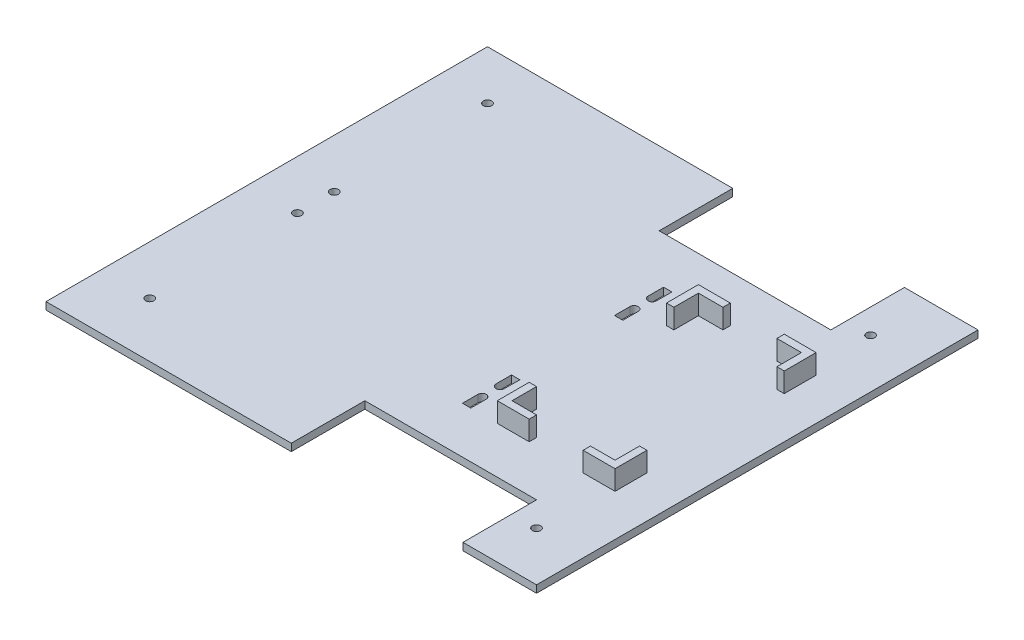
from build123d import *

# Parameters (mm, degrees)
SKETCH1_R           = 43.18
BOSS_EXTRUDE1_DEPTH = 76.2
BOSS_EXTRUDE4_DEPTH = 203.2


with BuildPart() as part:
    # Sketch1 → Boss-Extrude1 (new body)
    with BuildSketch(Plane(origin=(0, 0, 0), x_dir=(1, 0, 0), z_dir=(0, 1, 0))):
        Polygon((-48.943073508, 29.635887653), (1729.056926492, 29.635887653), (1729.056926492, -732.364112347), (2491.056926492, -732.364112347), (2491.056926492, 3839.635887653), (1729.056926492, 3839.635887653), (1729.056926492, 3077.635887653), (-48.943073508, 3077.635887653), (-48.943073508, 3839.635887653), (-2588.943073508, 3839.635887653), (-2588.943073508, -732.364112347), (-48.943073508, -732.364112347), align=None)
        with Locations((-2080.943073508, -166.508163088)):
            Circle(SKETCH1_R, mode=Mode.SUBTRACT)
        with Locations((-2080.943073508, 1744.135887653)):
            Circle(SKETCH1_R, mode=Mode.SUBTRACT)
        with Locations((-2080.943073508, 1363.135887653)):
            Circle(SKETCH1_R, mode=Mode.SUBTRACT)
        with Locations((-2080.943073508, 3331.635887653)):
            Circle(SKETCH1_R, mode=Mode.SUBTRACT)
        with Locations((1983.056926492, -224.364112347)):
            Circle(SKETCH1_R, mode=Mode.SUBTRACT)
        with Locations((1983.056926492, 3235.099053778)):
            Circle(SKETCH1_R, mode=Mode.SUBTRACT)
        with BuildLine():
            Line((565.736926492, 2435.015887653), (565.736926492, 2595.035887653))
            Line((565.736926492, 2595.035887653), (479.376926492, 2595.035887653))
            Line((479.376926492, 2595.035887653), (479.376926492, 2435.015887653))
            ThreePointArc((479.376926492, 2435.015887653), (522.556926492, 2391.835887653), (565.736926492, 2435.015887653))
        make_face(mode=Mode.SUBTRACT)
        with BuildLine():
            Line((565.736926492, 2247.055887653), (565.736926492, 2087.035887653))
            Line((565.736926492, 2087.035887653), (479.376926492, 2087.035887653))
            Line((479.376926492, 2087.035887653), (479.376926492, 2247.055887653))
            ThreePointArc((479.376926492, 2247.055887653), (522.556926492, 2290.235887653), (565.736926492, 2247.055887653))
        make_face(mode=Mode.SUBTRACT)
        with BuildLine():
            Line((479.376926492, 1020.235887653), (479.376926492, 860.215887653))
            ThreePointArc((479.376926492, 860.215887653), (522.556926492, 817.035887653), (565.736926492, 860.215887653))
            Line((565.736926492, 860.215887653), (565.736926492, 1020.235887653))
            Line((565.736926492, 1020.235887653), (479.376926492, 1020.235887653))
        make_face(mode=Mode.SUBTRACT)
        with BuildLine():
            Line((479.376926492, 512.235887653), (479.376926492, 672.255887653))
            ThreePointArc((479.376926492, 672.255887653), (522.556926492, 715.435887653), (565.736926492, 672.255887653))
            Line((565.736926492, 672.255887653), (565.736926492, 512.235887653))
            Line((565.736926492, 512.235887653), (479.376926492, 512.235887653))
        make_face(mode=Mode.SUBTRACT)
    extrude(amount=BOSS_EXTRUDE1_DEPTH)

    # Sketch2 → Boss-Extrude4 (add)
    with BuildSketch(Plane(origin=(0, 76.2, 0), x_dir=(1, 0, 0), z_dir=(0, 1, 0))):
        Polygon((2059.256926492, 512.235887653), (2059.256926492, 842.435887653), (1983.056926492, 842.435887653), (1983.056926492, 588.435887653), (1729.056926492, 588.435887653), (1729.056926492, 512.235887653), align=None)
        Polygon((840.056926492, 842.435887653), (916.256926492, 842.435887653), (916.256926492, 588.435887653), (1170.256926492, 588.435887653), (1170.256926492, 512.235887653), (840.056926492, 512.235887653), align=None)
        Polygon((840.056926492, 2595.035887653), (840.056926492, 2264.835887653), (916.256926492, 2264.835887653), (916.256926492, 2518.835887653), (1170.256926492, 2518.835887653), (1170.256926492, 2595.035887653), align=None)
        Polygon((2059.256926492, 2264.835887653), (1983.056926492, 2264.835887653), (1983.056926492, 2518.835887653), (1729.056926492, 2518.835887653), (1729.056926492, 2595.035887653), (2059.256926492, 2595.035887653), align=None)
    extrude(amount=BOSS_EXTRUDE4_DEPTH)


solid = part.part
